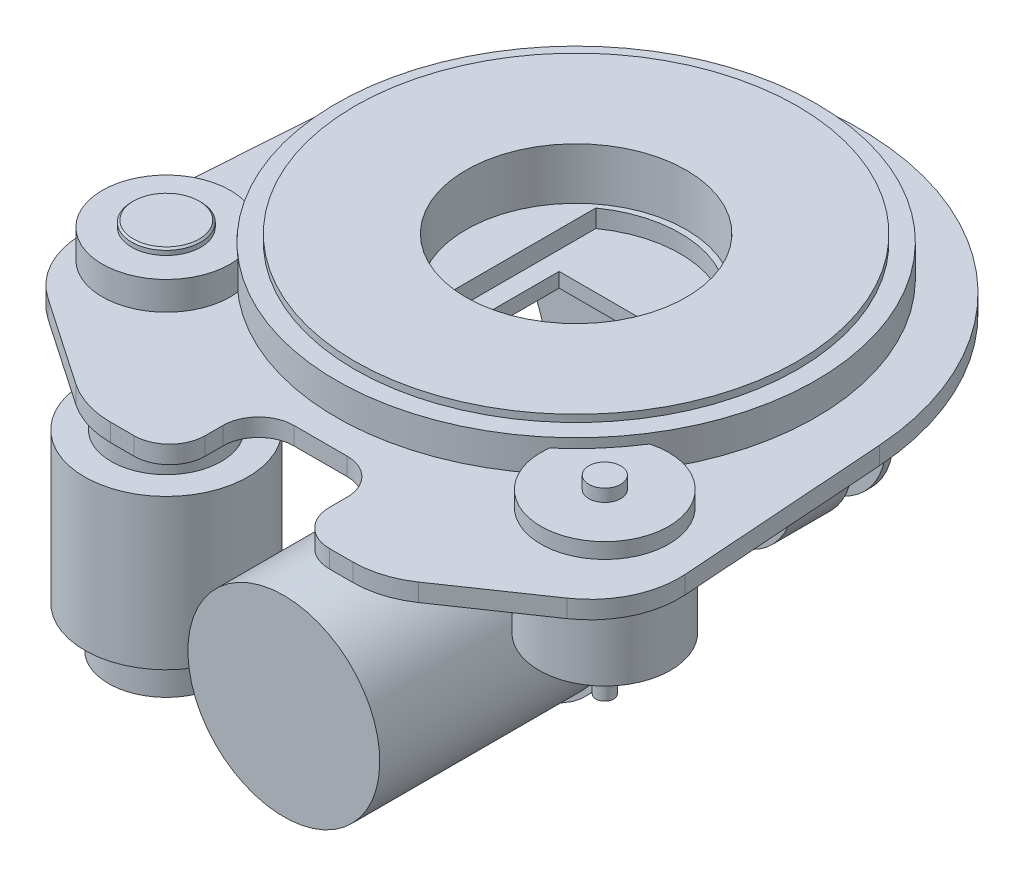
from build123d import *

# Parameters (mm, degrees)
ESTRUSIONE_ESTRUSIONE1_DEPTH      = 40
ESTRUSIONE_ESTRUSIONE2_DEPTH      = 70
SCHIZZO27_W                       = 50.85998704
SCHIZZO27_H                       = 8.16
ESTRUSIONE_ESTRUSIONE10_DEPTH     = 22.131
ESTRUSIONE_ESTRUSIONE5_DEPTH      = 3
ESTRUSIONE_ESTRUSIONE5_DEPTH_BACK = 5
SCHIZZO9_W                        = 33
SCHIZZO9_H                        = 41.5
SCHIZZO14_R                       = 5
ESTRUSIONE_ESTRUSIONE6_DEPTH      = 19
SCHIZZO15_R                       = 41.5
SCHIZZO15_R_2                     = 10
ESTRUSIONE_ESTRUSIONE7_DEPTH      = 4
SCHIZZO16_R                       = 5
ESTRUSIONE_ESTRUSIONE8_DEPTH      = 53
ESTRUSIONE_ESTRUSIONE9_DEPTH      = 10


# Read off the part's stored shape, not the designer's step: Estrusione-Estrusione2
with BuildPart() as part:
    # Schizzo1 → Estrusione-Estrusione1 (new body)
    with BuildSketch(Plane.XY):
        with BuildLine():
            Line((-35.838179279, -60.454520749), (-64.807485396, 23.440548807))
            ThreePointArc((-64.807485396, 23.440548807), (-64.915106011, 24.005921967), (-64.857270382, 24.57853357))
            Line((-64.857270382, 24.57853357), (-57.99999352, 52))
            Line((-57.99999352, 52), (57.99999352, 52))
            Line((57.99999352, 52), (64.857270382, 24.57853357))
            ThreePointArc((64.857270382, 24.57853357), (64.915106011, 24.005921967), (64.807485396, 23.440548807))
            Line((64.807485396, 23.440548807), (35.838179279, -60.454520749))
            ThreePointArc((35.838179279, -60.454520749), (0, -85.994059495), (-35.838179279, -60.454520749))
        make_face()
    extrude(amount=ESTRUSIONE_ESTRUSIONE1_DEPTH)

    # Estrusione-Estrusione2 outline → Estrusione-Estrusione2 (add)
    with BuildSketch(Plane.XY.offset(40)):
        with BuildLine():
            Line((57.99999352, 52), (25.42999352, 52))
            Line((25.42999352, 52), (25.42999352, 43.84))
            ThreePointArc((25.42999352, 43.84), (46.220051809, 36.161219578), (64.910772431, 24.251259249))
            ThreePointArc((64.910772431, 24.251259249), (64.890816245, 24.416007214), (64.857270382, 24.57853357))
            Line((64.857270382, 24.57853357), (57.99999352, 52))
        make_face()
        with BuildLine():
            Line((-25.42999352, 52), (-57.99999352, 52))
            Line((-57.99999352, 52), (-64.857270382, 24.57853357))
            ThreePointArc((-64.857270382, 24.57853357), (-64.890816245, 24.416007214), (-64.910772431, 24.251259249))
            ThreePointArc((-64.910772431, 24.251259249), (-46.220051809, 36.161219578), (-25.42999352, 43.84))
            Line((-25.42999352, 43.84), (-25.42999352, 52))
        make_face()
    extrude(amount=ESTRUSIONE_ESTRUSIONE2_DEPTH)

    # Schizzo27 → Estrusione-Estrusione10 (add)
    with BuildSketch(Plane.XY.offset(40)):
        with Locations((0, 47.92)):
            Rectangle(SCHIZZO27_W, SCHIZZO27_H)
    extrude(amount=ESTRUSIONE_ESTRUSIONE10_DEPTH)

    # Schizzo12 → Estrusione-Estrusione5 (add, two sides: drawn at the far end of the back side and taken through both)
    with BuildSketch(Plane(origin=(0, 0, 0), x_dir=(-1, 0, 0), z_dir=(0, 0, -1)).offset(-ESTRUSIONE_ESTRUSIONE5_DEPTH_BACK)):
        with BuildLine():
            ThreePointArc((8.764790291, -25.537784774), (0, 27), (-8.764790291, -25.537784774))
            ThreePointArc((-8.764790291, -25.537784774), (0, -96.454520749), (8.764790291, -25.537784774))
        make_face()
    extrude(amount=ESTRUSIONE_ESTRUSIONE5_DEPTH + ESTRUSIONE_ESTRUSIONE5_DEPTH_BACK)

    # Schizzo9 → Rivoluzione4 (revolve)
    with BuildSketch(Plane(origin=(0, 0, 0), x_dir=(0, 0, -1), z_dir=(1, 0, 0))):
        Polygon((-40, -46.994520749), (-59.49, -46.994520749), (-59.49, -39.494520749), (-70.49, -39.494520749), (-70.49, -24.494520749), (-103.49, -24.494520749), (-103.49, -0.244520749), (-112.49, -0.244520749), (-112.49, -2.994520749), (-242.49, -2.994520749), (-242.49, -56.994520749), (-40, -56.994520749), align=None)
        with Locations((19.5, -36.244520749)):
            Rectangle(SCHIZZO9_W, SCHIZZO9_H)
    revolve(axis=Axis((0, -56.994520749, 40), (0, 0, 1)))

    # Schizzo14 → Estrusione-Estrusione6 (add)
    with BuildSketch(Plane(origin=(0, 0, -36), x_dir=(-1, 0, 0), z_dir=(0, 0, -1))):
        with Locations((0, -84.661187416)):
            Circle(SCHIZZO14_R)
        with Locations((-23.962922923, -43.156187416)):
            Circle(SCHIZZO14_R)
        with Locations((23.962922923, -43.156187416)):
            Circle(SCHIZZO14_R)
    extrude(amount=ESTRUSIONE_ESTRUSIONE6_DEPTH)

    # Schizzo15 → Estrusione-Estrusione7 (add)
    with BuildSketch(Plane(origin=(0, 0, -55), x_dir=(-1, 0, 0), z_dir=(0, 0, -1))):
        with Locations(Location((0, -56.994520749, 0), (0, 0, 90))):
            Circle(SCHIZZO15_R)
        with Locations(Location((0, -56.994520749, 0), (0, 0, 90))):
            Circle(SCHIZZO15_R_2, mode=Mode.SUBTRACT)
    extrude(amount=ESTRUSIONE_ESTRUSIONE7_DEPTH)

    # Schizzo16 → Estrusione-Estrusione8 (add)
    with BuildSketch(Plane(origin=(0, 0, -36), x_dir=(-1, 0, 0), z_dir=(0, 0, -1))):
        with Locations((0, -56.994520749)):
            Circle(SCHIZZO16_R)
    extrude(amount=ESTRUSIONE_ESTRUSIONE8_DEPTH)

    # Schizzo17 → Estrusione-Estrusione9 (add)
    with BuildSketch(Plane(origin=(0, 52, 0), x_dir=(1, 0, 0), z_dir=(0, 1, 0))):
        with BuildLine():
            Line((-159.445, -66.608848829), (-167.720236988, -184.359565795))
            ThreePointArc((-167.720236988, -184.359565795), (-162.859060274, -209.626630738), (-146.076696991, -229.130678845))
            Line((-146.076696991, -229.130678845), (-96.455754418, -263.080519362))
            ThreePointArc((-96.455754418, -263.080519362), (-82.999085751, -269.581228991), (-68.222312421, -271.814640564))
            Line((-68.222312421, -271.814640564), (-54.96, -271.814640564))
            ThreePointArc((-54.96, -271.814640564), (-40.817864376, -265.956776188), (-34.96, -251.814640564))
            Line((-34.96, -251.814640564), (-34.96, -241.814640564))
            ThreePointArc((-34.96, -241.814640564), (-29.102135624, -227.67250494), (-14.96, -221.814640564))
            Line((-14.96, -221.814640564), (14.96, -221.814640564))
            ThreePointArc((14.96, -221.814640564), (29.102135624, -227.67250494), (34.96, -241.814640564))
            Line((34.96, -241.814640564), (34.96, -251.814640564))
            ThreePointArc((34.96, -251.814640564), (40.817864376, -265.956776188), (54.96, -271.814640564))
            Line((54.96, -271.814640564), (68.222312421, -271.814640564))
            ThreePointArc((68.222312421, -271.814640564), (82.999085751, -269.581228991), (96.455754418, -263.080519362))
            Line((96.455754418, -263.080519362), (146.076696991, -229.130678845))
            ThreePointArc((146.076696991, -229.130678845), (162.859060274, -209.626630738), (167.720236988, -184.359565795))
            Line((167.720236988, -184.359565795), (159.445, -66.608848829))
            ThreePointArc((159.445, -66.608848829), (0, 82.024), (-159.445, -66.608848829))
        make_face()
        with BuildLine():
            Line((-36, -30.9285), (-36, -125.0235))
            ThreePointArc((-36, -125.0235), (0, -136.545782144), (36, -125.0235))
            Line((36, -125.0235), (36, -30.9285))
            ThreePointArc((36, -30.9285), (0, -19.406217856), (-36, -30.9285))
        make_face(mode=Mode.SUBTRACT)
    extrude(amount=ESTRUSIONE_ESTRUSIONE9_DEPTH)

    # Schizzo19 → Rivoluzione5 (revolve)
    with BuildSketch(Plane(origin=(0, 0, 0), x_dir=(0, 0, -1), z_dir=(1, 0, 0))):
        Polygon((57.024, 87), (57.024, 69), (12.024, 69), (12.024, 62), (-15.976, 62), (-15.976, 91), (46.524, 91), (46.524, 87), align=None)
    revolve(axis=Axis((0, -948, 77.976), (0, 1, 0)))

    # Schizzo23 → Rivoluzione6 (revolve)
    with BuildSketch(Plane.XY.offset(185.24165124)):
        Polygon((-123.395016366, 62), (-138.395016366, 62), (-138.395016366, 70.1), (-159.395016366, 70.1), (-159.395016366, 86.1), (-142.895016366, 86.1), (-142.895016366, 88.6), (-141.895016366, 89.6), (-123.395016366, 89.6), align=None)
        Polygon((-123.395016366, 52), (-154.395016366, 52), (-154.395016366, -12.6), (-169.395016366, -12.6), (-169.395016366, -97.1), (-163.895016366, -97.1), (-163.895016366, -100.1), (-155.895016366, -100.1), (-155.895016366, -120.1), (-123.395016366, -120.1), align=None)
    revolve(axis=Axis((-123.395016366, 62, 185.24165124), (0, -1, 0)))

    # Schizzo24 → Rivoluzione7 (revolve)
    with BuildSketch(Plane.XY.offset(185.24165124), mode=Mode.PRIVATE) as rivoluzione7_sk:
        Polygon((123.4, 62), (123.4, 88.7), (132.4, 88.7), (132.4, 81.7), (159.4, 81.7), (159.4, 73), (132.4, 73), (132.4, 62), align=None)
        Polygon((123.4, 52), (123.4, -18), (128.4, -18), (128.4, 12), (160.4, 12), (160.4, 52), align=None)
    revolve(rivoluzione7_sk.sketch.rotate(Axis((123.4, -18, 185.24165124), (0, 1, 0)), 90), axis=Axis((123.4, -18, 185.24165124), (0, 1, 0)))


solid = part.part
